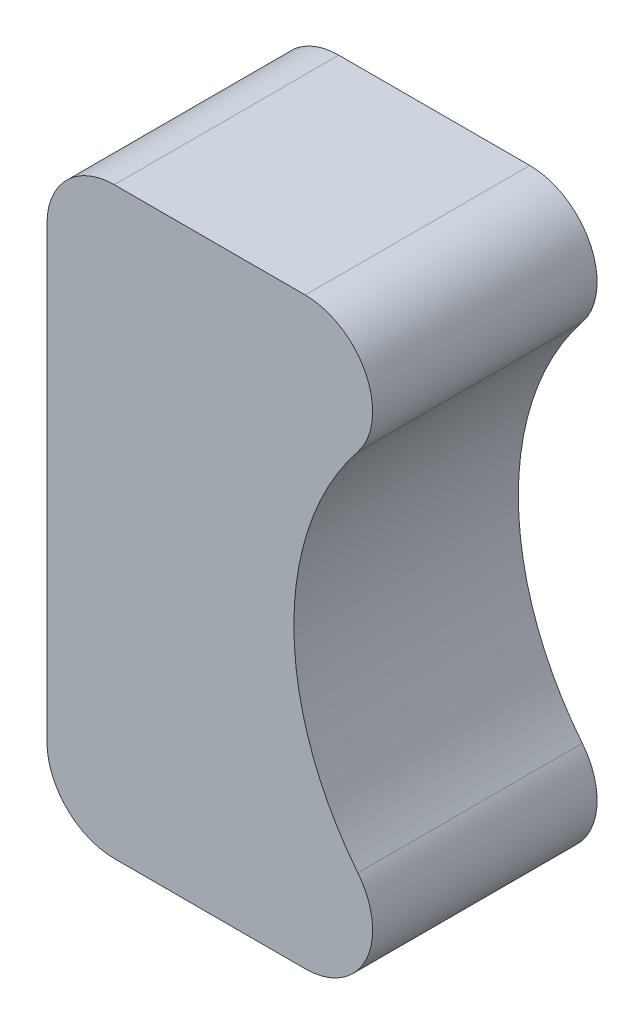
from build123d import *

# Parameters (mm, degrees)
SKETCH1_W           = 12
SKETCH1_H           = 13
BOSS_EXTRUDE1_DEPTH = 5
SKETCH3_R           = 6.5
CUT_EXTRUDE1_DEPTH  = 9
SKETCH4_R           = 1.75
CUT_EXTRUDE2_DEPTH  = 3
FILLET1_START       = -1
FILLET1_DEPTH       = 7
FILLET2_R           = 1.5


with BuildPart() as part:
    # Sketch1 → Boss-Extrude1 (new body)
    with BuildSketch(Plane.XY):
        with Locations((6, 6.5)):
            Rectangle(SKETCH1_W, SKETCH1_H)
    extrude(amount=BOSS_EXTRUDE1_DEPTH)

    # Sketch3 → Cut-Extrude1 (cut)
    with BuildSketch(Plane.XY.offset(5)):
        with Locations((12, 6.5)):
            Circle(SKETCH3_R)
    extrude(amount=-CUT_EXTRUDE1_DEPTH, mode=Mode.SUBTRACT)

    # Sketch4 → Cut-Extrude2 (cut)
    with BuildSketch(Plane.ZY):
        with Locations((2.5, 6.5)):
            Circle(SKETCH4_R)
    extrude(amount=-CUT_EXTRUDE2_DEPTH, mode=Mode.SUBTRACT)

    # Fillet1: read off the stored shape, not the designer's step
    # Fillet1 outline → Fillet1 (cut)
    with BuildSketch(Plane.XY.offset(FILLET1_START)):
        with BuildLine():
            ThreePointArc((5.755002002, 13), (7.10708373, 12.149519053), (6.925939126, 10.5625))
            ThreePointArc((6.925939126, 10.5625), (9.185417438, 12.359020823), (12, 13))
            Line((12, 13), (5.755002002, 13))
        make_face()
        with BuildLine():
            ThreePointArc((6.925939126, 2.4375), (7.10708373, 0.850480947), (5.755002002, 0))
            Line((5.755002002, 0), (12, 0))
            ThreePointArc((12, 0), (9.185417438, 0.640979177), (6.925939126, 2.4375))
        make_face()
    extrude(amount=FILLET1_DEPTH, mode=Mode.SUBTRACT)

    # Fillet2
    fillet2_edges = [part.edges().sort_by_distance(p)[0] for p in [
        (0, 13, 2.5),
        (0, 0, 2.5),
    ]]
    fillet(fillet2_edges, radius=FILLET2_R)


solid = part.part
